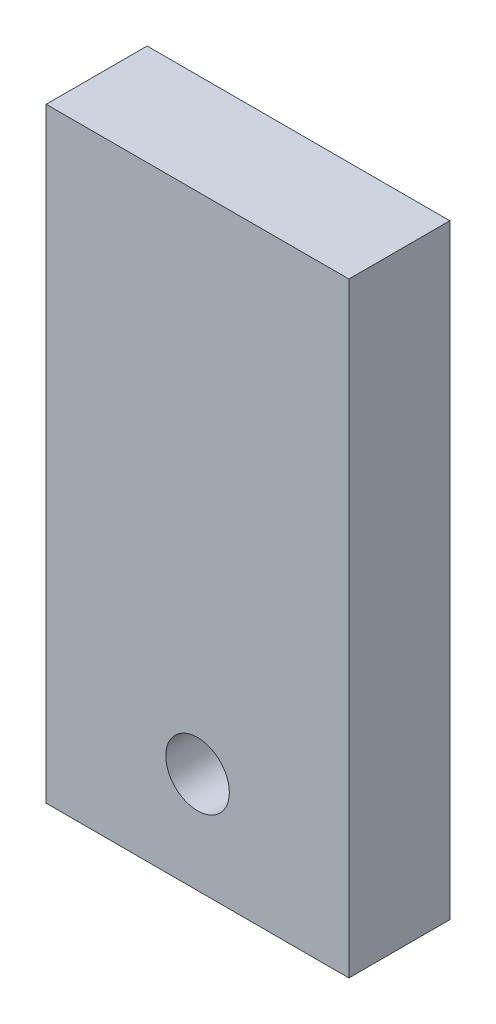
from build123d import *

# Parameters (mm, degrees)
BOSS_EXTRUDE1_DEPTH = 12.7
SKETCH2_R           = 4
CUT_EXTRUDE1_DEPTH  = 45.45


with BuildPart() as part:
    # Sketch1 → Boss-Extrude1 (new body)
    with BuildSketch(Plane.XY):
        Polygon((-19.05, 38.1), (-19.05, -38.1), (-12.7, -38.1), (12.7, -38.1), (19.05, -38.1), (19.05, 38.1), (12.7, 38.1), (-12.7, 38.1), align=None)
    extrude(amount=BOSS_EXTRUDE1_DEPTH)

    # Sketch2 → Cut-Extrude1 (cut, through all)
    with BuildSketch(Plane.XY.offset(12.7)):
        with Locations((0, -25.4)):
            Circle(SKETCH2_R)
    extrude(amount=-CUT_EXTRUDE1_DEPTH, mode=Mode.SUBTRACT)


solid = part.part
